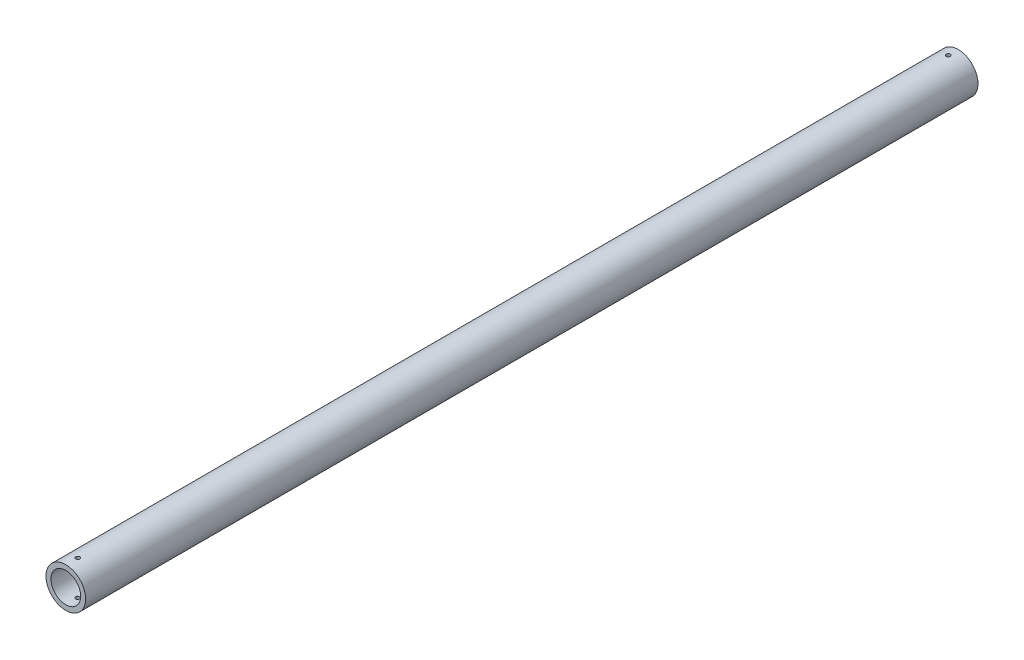
from build123d import *

# Parameters (mm, degrees)
SKETCH_1_R          = 10
SKETCH_1_R_2        = 7.5
EXTRUDE_1_DEPTH     = 450
SKETCH_2_R          = 1
CUT_EXTRUDE_2_DEPTH = 20
SKETCH_3_R          = 1
CUT_EXTRUDE_3_DEPTH = 20


with BuildPart() as part:
    # Эскиз1 → Вытянуть1 (new body)
    with BuildSketch(Plane.XY):
        Circle(SKETCH_1_R)
        Circle(SKETCH_1_R_2, mode=Mode.SUBTRACT)
    extrude(amount=EXTRUDE_1_DEPTH)

    # Эскиз2 → Вытянуть2 (cut, symmetric)
    with BuildSketch(Plane(origin=(0, 0, 0), x_dir=(1, 0, 0), z_dir=(0, 1, 0))):
        with Locations((0, -5)):
            Circle(SKETCH_2_R)
    extrude(amount=CUT_EXTRUDE_2_DEPTH, both=True, mode=Mode.SUBTRACT)

    # Эскиз3 → Вытянуть3 (cut, symmetric)
    with BuildSketch(Plane(origin=(0, 0, 0), x_dir=(1, 0, 0), z_dir=(0, 1, 0))):
        with Locations((0, -444)):
            Circle(SKETCH_3_R)
    extrude(amount=CUT_EXTRUDE_3_DEPTH, both=True, mode=Mode.SUBTRACT)


solid = part.part
